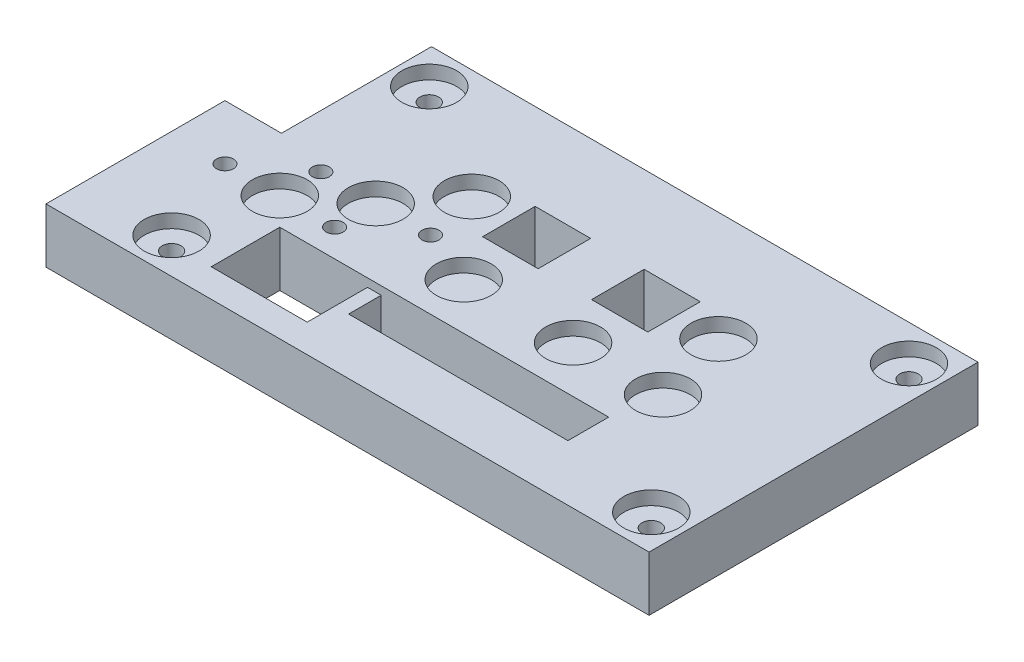
from build123d import *

# Parameters (mm, degrees)
SKETCH1_W               = 220
SKETCH1_H               = 120
BOSS_EXTRUDE1_DEPTH     = 20
CUT_EXTRUDE1_REACH      = 128.886
SKETCH2_W               = 20.632503002
SKETCH2_H               = 54.730004003
CUT_EXTRUDE2_REACH      = 128.886
SKETCH3_W               = 20.25
SKETCH3_H               = 19.16
SKETCH3_W_2             = 20.5
CUT_EXTRUDE3_REACH      = 128.886
SKETCH4_W               = 80
SKETCH4_H               = 14.88
CUT_EXTRUDE4_REACH      = 128.886
SKETCH8_R               = 3.1
CUT_EXTRUDE5_REACH      = 128.886
CUT_EXTRUDE6_DEPTH      = 127.885775404
CUT_EXTRUDE6_DEPTH_BACK = 5
SKETCH10_R              = 10
M8_TAPPED_HOLE1_D       = 6.8


with BuildPart() as part:
    # Sketch1 → Boss-Extrude1 (new body)
    with BuildSketch(Plane(origin=(0, 0, 0), x_dir=(1, 0, 0), z_dir=(0, 1, 0))):
        Rectangle(SKETCH1_W, SKETCH1_H)
    extrude(amount=-BOSS_EXTRUDE1_DEPTH)

    # Sketch2 → Cut-Extrude1 (cut, up to next)
    with BuildSketch(Plane(origin=(0, 0, 0), x_dir=(1, 0, 0), z_dir=(0, 1, 0)), mode=Mode.PRIVATE) as cut_extrude1_sk1:
        with Locations((-99.683748499, 32.634997999)):
            Rectangle(SKETCH2_W, SKETCH2_H)
    cut_extrude1_tool1 = extrude(cut_extrude1_sk1.sketch, amount=-CUT_EXTRUDE1_REACH, mode=Mode.PRIVATE) & part.part
    add(cut_extrude1_tool1.solids().sort_by_distance((-99.683748, 0, -32.634998))[0], mode=Mode.SUBTRACT)

    # Sketch3 → Cut-Extrude2 (cut, up to next)
    with BuildSketch(Plane(origin=(0, 0, 0), x_dir=(1, 0, 0), z_dir=(0, 1, 0)), mode=Mode.PRIVATE) as cut_extrude2_sk1:
        with Locations((-9.875, 18.86)):
            Rectangle(SKETCH3_W, SKETCH3_H)
    cut_extrude2_tool1 = extrude(cut_extrude2_sk1.sketch, amount=-CUT_EXTRUDE2_REACH, mode=Mode.PRIVATE) & part.part
    # Sketch3 → Cut-Extrude2 (cut, up to next)
    with BuildSketch(Plane(origin=(0, 0, 0), x_dir=(1, 0, 0), z_dir=(0, 1, 0)), mode=Mode.PRIVATE) as cut_extrude2_sk2:
        with Locations((30, 18.86)):
            Rectangle(SKETCH3_W_2, SKETCH3_H)
    cut_extrude2_tool2 = extrude(cut_extrude2_sk2.sketch, amount=-CUT_EXTRUDE2_REACH, mode=Mode.PRIVATE) & part.part
    add(cut_extrude2_tool1.solids().sort_by_distance((-9.875, 0, -18.86))[0], mode=Mode.SUBTRACT)
    add(cut_extrude2_tool2.solids().sort_by_distance((30, 0, -18.86))[0], mode=Mode.SUBTRACT)

    # Sketch4 → Cut-Extrude3 (cut, up to next)
    with BuildSketch(Plane(origin=(0, 0, 0), x_dir=(1, 0, 0), z_dir=(0, 1, 0)), mode=Mode.PRIVATE) as cut_extrude3_sk1:
        with Locations((20, -32.16)):
            Rectangle(SKETCH4_W, SKETCH4_H)
    cut_extrude3_tool1 = extrude(cut_extrude3_sk1.sketch, amount=-CUT_EXTRUDE3_REACH, mode=Mode.PRIVATE) & part.part
    add(cut_extrude3_tool1.solids().sort_by_distance((20, 0, 32.16))[0], mode=Mode.SUBTRACT)

    # Sketch8 → Cut-Extrude4 (cut, up to next)
    with BuildSketch(Plane(origin=(0, 0, 0), x_dir=(1, 0, 0), z_dir=(0, 1, 0)), mode=Mode.PRIVATE) as cut_extrude4_sk1:
        with Locations((-90, -14.72)):
            Circle(SKETCH8_R)
    cut_extrude4_tool1 = extrude(cut_extrude4_sk1.sketch, amount=-CUT_EXTRUDE4_REACH, mode=Mode.PRIVATE) & part.part
    # Sketch8 → Cut-Extrude4 (cut, up to next)
    with BuildSketch(Plane(origin=(0, 0, 0), x_dir=(1, 0, 0), z_dir=(0, 1, 0)), mode=Mode.PRIVATE) as cut_extrude4_sk2:
        with Locations((-30, 0.28)):
            Circle(SKETCH8_R)
    cut_extrude4_tool2 = extrude(cut_extrude4_sk2.sketch, amount=-CUT_EXTRUDE4_REACH, mode=Mode.PRIVATE) & part.part
    # Sketch8 → Cut-Extrude4 (cut, up to next)
    with BuildSketch(Plane(origin=(0, 0, 0), x_dir=(1, 0, 0), z_dir=(0, 1, 0)), mode=Mode.PRIVATE) as cut_extrude4_sk3:
        with Locations((-70, 0.28)):
            Circle(SKETCH8_R)
    cut_extrude4_tool3 = extrude(cut_extrude4_sk3.sketch, amount=-CUT_EXTRUDE4_REACH, mode=Mode.PRIVATE) & part.part
    # Sketch8 → Cut-Extrude4 (cut, up to next)
    with BuildSketch(Plane(origin=(0, 0, 0), x_dir=(1, 0, 0), z_dir=(0, 1, 0)), mode=Mode.PRIVATE) as cut_extrude4_sk4:
        with Locations((-50, -14.72)):
            Circle(SKETCH8_R)
    cut_extrude4_tool4 = extrude(cut_extrude4_sk4.sketch, amount=-CUT_EXTRUDE4_REACH, mode=Mode.PRIVATE) & part.part
    add(cut_extrude4_tool1.solids().sort_by_distance((-90, 0, 14.72))[0], mode=Mode.SUBTRACT)
    add(cut_extrude4_tool2.solids().sort_by_distance((-30, 0, -0.28))[0], mode=Mode.SUBTRACT)
    add(cut_extrude4_tool3.solids().sort_by_distance((-70, 0, -0.28))[0], mode=Mode.SUBTRACT)
    add(cut_extrude4_tool4.solids().sort_by_distance((-50, 0, 14.72))[0], mode=Mode.SUBTRACT)

    # Sketch9 → Cut-Extrude5 (cut, up to next)
    with BuildSketch(Plane(origin=(0, 0, 0), x_dir=(1, 0, 0), z_dir=(0, 1, 0)), mode=Mode.PRIVATE) as cut_extrude5_sk1:
        Polygon((-20, -27.72), (-25, -27.72), (-25, -49.72), (-60, -49.72), (-60, -24.72), (-20, -24.72), align=None)
    cut_extrude5_tool1 = extrude(cut_extrude5_sk1.sketch, amount=-CUT_EXTRUDE5_REACH, mode=Mode.PRIVATE) & part.part
    add(cut_extrude5_tool1.solids().sort_by_distance((-42.162921, 0, 37.034607))[0], mode=Mode.SUBTRACT)

    # Sketch10 → Cut-Extrude6 (cut, two sides: drawn at the far end of the back side and taken through both)
    with BuildSketch(Plane(origin=(0, 0, 0), x_dir=(1, 0, 0), z_dir=(0, 1, 0)).offset(-CUT_EXTRUDE6_DEPTH_BACK)):
        with Locations((-77.183748499, 47)):
            Circle(SKETCH10_R)
        with Locations((-34.683748499, 20)):
            Circle(SKETCH10_R)
        with Locations((97.816251501, 47)):
            Circle(SKETCH10_R)
        with Locations((30, -7.72)):
            Circle(SKETCH10_R)
        with Locations((55.316251501, 20)):
            Circle(SKETCH10_R)
        with Locations((-9.875, -7.72)):
            Circle(SKETCH10_R)
        with Locations((97.816251501, -47)):
            Circle(SKETCH10_R)
        with Locations((-50, 0.28)):
            Circle(SKETCH10_R)
        with Locations((62.816251501, -7.72)):
            Circle(SKETCH10_R)
        with Locations((-70, -14.72)):
            Circle(SKETCH10_R)
        with Locations((-77.183748499, -47)):
            Circle(SKETCH10_R)
    extrude(amount=CUT_EXTRUDE6_DEPTH + CUT_EXTRUDE6_DEPTH_BACK, mode=Mode.SUBTRACT)

    # M8 Tapped Hole1 (through all)
    with Locations(Plane(origin=(0, -5, 0), x_dir=(1, 0, 0), z_dir=(0, 1, 0))):
        with Locations((-77.183748499, 47), (97.816251501, 47), (97.816251501, -47), (-77.183748499, -47)):
            Hole(M8_TAPPED_HOLE1_D / 2)


solid = part.part
